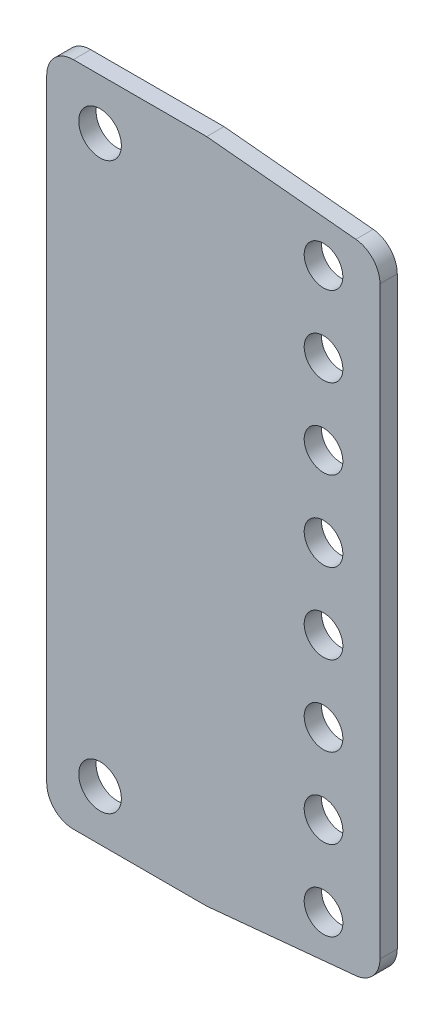
from build123d import *

# Parameters (mm, degrees)
SKETCH1_R           = 1.6
SKETCH1_R_2         = 1.45
BOSS_EXTRUDE1_DEPTH = 1.3
FILLET1_R           = 2


with BuildPart() as part:
    # Sketch1 → Boss-Extrude1 (new body)
    with BuildSketch(Plane.XY):
        Polygon((12, 50), (25, 48.75), (25, 1.25), (12, 0), (0, 0), (0, 50), align=None)
        with Locations((4, 46.213205)):
            Circle(SKETCH1_R, mode=Mode.SUBTRACT)
        with Locations((4, 3.786795)):
            Circle(SKETCH1_R, mode=Mode.SUBTRACT)
        with Locations((20.766795, 46)):
            Circle(SKETCH1_R_2, mode=Mode.SUBTRACT)
        with Locations((20.766795, 4)):
            Circle(SKETCH1_R_2, mode=Mode.SUBTRACT)
        with Locations((20.766795, 40)):
            Circle(SKETCH1_R_2, mode=Mode.SUBTRACT)
        with Locations((20.766795, 34)):
            Circle(SKETCH1_R_2, mode=Mode.SUBTRACT)
        with Locations((20.766795, 28)):
            Circle(SKETCH1_R_2, mode=Mode.SUBTRACT)
        with Locations((20.766795, 22)):
            Circle(SKETCH1_R_2, mode=Mode.SUBTRACT)
        with Locations((20.766795, 16)):
            Circle(SKETCH1_R_2, mode=Mode.SUBTRACT)
        with Locations((20.766795, 10)):
            Circle(SKETCH1_R_2, mode=Mode.SUBTRACT)
    extrude(amount=BOSS_EXTRUDE1_DEPTH)

    # Fillet1
    fillet1_edges = [part.edges().sort_by_distance(p)[0] for p in [
        (25, 48.75, 0.65),
        (25, 1.25, 0.65),
        (0, 0, 0.65),
        (0, 50, 0.65),
    ]]
    fillet(fillet1_edges, radius=FILLET1_R)


solid = part.part
